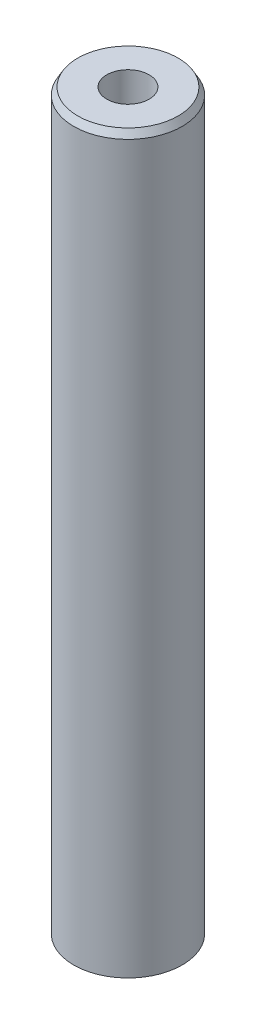
from build123d import *
from OCP.BRepFilletAPI import BRepFilletAPI_MakeChamfer

# Parameters (mm, degrees)
SKETCH1_R           = 35
BOSS_EXTRUDE1_DEPTH = 475.651455258
SKETCH2_R           = 13.674085345
CUT_EXTRUDE1_DEPTH  = 479.219935688
CHAMFER1_SIZE       = 4.528496764
CHAMFER1_SIZE2      = 2.614528826


with BuildPart() as part:
    # Sketch1 → Boss-Extrude1 (new body)
    with BuildSketch(Plane(origin=(0, 0, 0), x_dir=(1, 0, 0), z_dir=(0, 1, 0))):
        Circle(SKETCH1_R)
    extrude(amount=BOSS_EXTRUDE1_DEPTH)

    # Sketch2 → Cut-Extrude1 (cut, through all)
    with BuildSketch(Plane(origin=(0, 0, 0), x_dir=(1, 0, 0), z_dir=(0, 1, 0))):
        Circle(SKETCH2_R)
    extrude(amount=CUT_EXTRUDE1_DEPTH, mode=Mode.SUBTRACT)

    # Chamfer1: one chamfer whose edges measure the first distance from different faces: ONE call of the kernel's chamfer builder (chamfer() names one face for all edges)
    chamfer1_edges_1 = [part.edges().sort_by_distance(p)[0] for p in [
        (-35, 475.651455258, 0),
    ]]
    chamfer1_side_1 = [part.faces().sort_by_distance(p)[0] for p in [
        (-35, 237.825727629, 0),
    ]]
    chamfer1_edges_2 = [part.edges().sort_by_distance(p)[0] for p in [
        (-35, 0, 0),
    ]]
    chamfer1_side_2 = [part.faces().sort_by_distance(p)[0] for p in [
        (-34.010050506, 0, 0),
    ]]
    chamfer1 = BRepFilletAPI_MakeChamfer(part.part.solid().wrapped)
    for e in chamfer1_edges_1:
        chamfer1.Add(CHAMFER1_SIZE, CHAMFER1_SIZE2, e.wrapped, chamfer1_side_1[0].wrapped)  # the first distance lies on this face
    for e in chamfer1_edges_2:
        chamfer1.Add(CHAMFER1_SIZE, CHAMFER1_SIZE2, e.wrapped, chamfer1_side_2[0].wrapped)  # the first distance lies on this face
    add(Compound.cast(chamfer1.Shape()), mode=Mode.REPLACE)


solid = part.part
